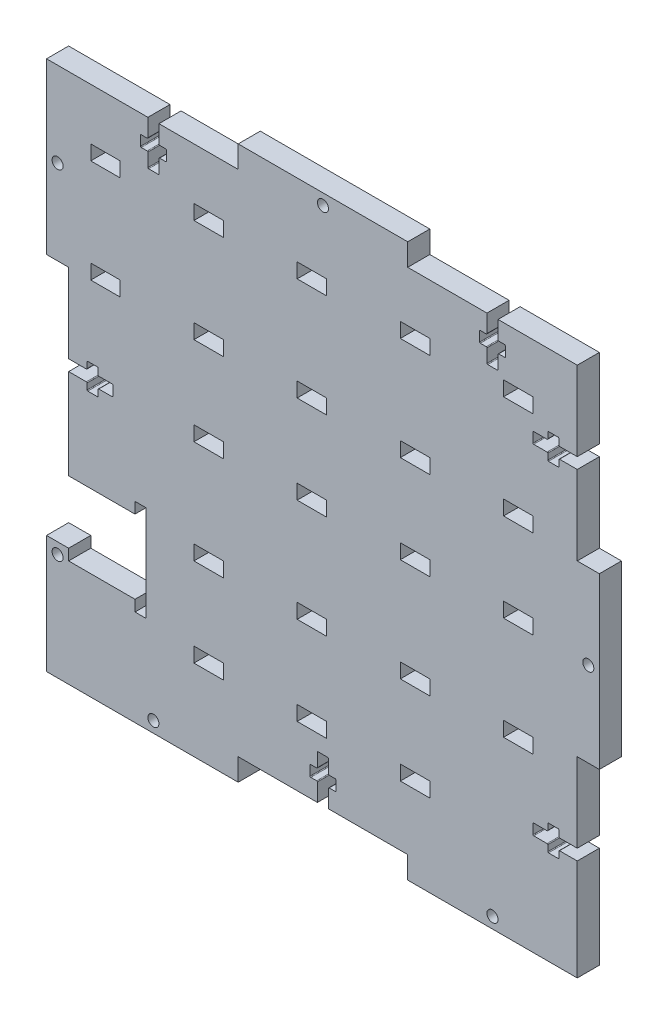
from build123d import *

# Parameters (mm, degrees)
BOX_SIDE_DEPTH       = 6
SKETCH2_R            = 1.5
SCREW_CUT_OUTS_DEPTH = 107.235587258
CUT_EXTRUDE1_DEPTH   = 107.235587258
SKETCH4_W            = 8
SKETCH4_H            = 4
CUT_EXTRUDE2_DEPTH   = 107.235587258


with BuildPart() as part:
    # Sketch1 → Box Side (new body)
    with BuildSketch(Plane.XY):
        Polygon((-69, 69), (-23, 69), (-23, 75), (23, 75), (23, 69), (69, 69), (69, 23), (75, 23), (75, -23), (69, -23), (69, -69), (69, -75), (23, -75), (23, -69), (-23, -69), (-23, -75), (-69, -75), (-75, -75), (-75, -69), (-75, -23), (-69, -23), (-69, 23), (-75, 23), (-75, 69), align=None)
    extrude(amount=BOX_SIDE_DEPTH)

    # Sketch2 → Screw Cut-outs (cut, through all)
    with BuildSketch(Plane.XY.offset(6)):
        with Locations((0, 72)):
            Circle(SKETCH2_R)
        with Locations((72, 0)):
            Circle(SKETCH2_R)
        with Locations((-46, -72)):
            Circle(SKETCH2_R)
        with Locations((46, -72)):
            Circle(SKETCH2_R)
        with Locations((-72, 46)):
            Circle(SKETCH2_R)
        with Locations((-72, -46)):
            Circle(SKETCH2_R)
        with BuildLine():
            Line((-44.5, 69), (-44.5, 64.2))
            ThreePointArc((-44.5, 64.2), (-44.441421356, 64.058578644), (-44.3, 64))
            Line((-44.3, 64), (-42.7, 64))
            ThreePointArc((-42.7, 64), (-42.558578644, 63.941421356), (-42.5, 63.8))
            Line((-42.5, 63.8), (-42.5, 61.2))
            ThreePointArc((-42.5, 61.2), (-42.558578644, 61.058578644), (-42.7, 61))
            Line((-42.7, 61), (-44.3, 61))
            ThreePointArc((-44.3, 61), (-44.441421356, 60.941421356), (-44.5, 60.8))
            Line((-44.5, 60.8), (-44.5, 57.2))
            ThreePointArc((-44.5, 57.2), (-44.558578644, 57.058578644), (-44.7, 57))
            Line((-44.7, 57), (-47.3, 57))
            ThreePointArc((-47.3, 57), (-47.441421356, 57.058578644), (-47.5, 57.2))
            Line((-47.5, 57.2), (-47.5, 60.8))
            ThreePointArc((-47.5, 60.8), (-47.558578644, 60.941421356), (-47.7, 61))
            Line((-47.7, 61), (-49.3, 61))
            ThreePointArc((-49.3, 61), (-49.441421356, 61.058578644), (-49.5, 61.2))
            Line((-49.5, 61.2), (-49.5, 63.8))
            ThreePointArc((-49.5, 63.8), (-49.441421356, 63.941421356), (-49.3, 64))
            Line((-49.3, 64), (-47.7, 64))
            ThreePointArc((-47.7, 64), (-47.558578644, 64.058578644), (-47.5, 64.2))
            Line((-47.5, 64.2), (-47.5, 69))
            Line((-47.5, 69), (-44.5, 69))
        make_face()
        with BuildLine():
            Line((47.5, 69), (47.5, 64.2))
            ThreePointArc((47.5, 64.2), (47.558578644, 64.058578644), (47.7, 64))
            Line((47.7, 64), (49.3, 64))
            ThreePointArc((49.3, 64), (49.441421356, 63.941421356), (49.5, 63.8))
            Line((49.5, 63.8), (49.5, 61.2))
            ThreePointArc((49.5, 61.2), (49.441421356, 61.058578644), (49.3, 61))
            Line((49.3, 61), (47.7, 61))
            ThreePointArc((47.7, 61), (47.558578644, 60.941421356), (47.5, 60.8))
            Line((47.5, 60.8), (47.5, 57.2))
            ThreePointArc((47.5, 57.2), (47.441421356, 57.058578644), (47.3, 57))
            Line((47.3, 57), (44.7, 57))
            ThreePointArc((44.7, 57), (44.558578644, 57.058578644), (44.5, 57.2))
            Line((44.5, 57.2), (44.5, 60.8))
            ThreePointArc((44.5, 60.8), (44.441421356, 60.941421356), (44.3, 61))
            Line((44.3, 61), (42.7, 61))
            ThreePointArc((42.7, 61), (42.558578644, 61.058578644), (42.5, 61.2))
            Line((42.5, 61.2), (42.5, 63.8))
            ThreePointArc((42.5, 63.8), (42.558578644, 63.941421356), (42.7, 64))
            Line((42.7, 64), (44.3, 64))
            ThreePointArc((44.3, 64), (44.441421356, 64.058578644), (44.5, 64.2))
            Line((44.5, 64.2), (44.5, 69))
            Line((44.5, 69), (47.5, 69))
        make_face()
        with BuildLine():
            Line((69, 44.5), (64.2, 44.5))
            ThreePointArc((64.2, 44.5), (64.058578644, 44.441421356), (64, 44.3))
            Line((64, 44.3), (64, 42.7))
            ThreePointArc((64, 42.7), (63.941421356, 42.558578644), (63.8, 42.5))
            Line((63.8, 42.5), (61.2, 42.5))
            ThreePointArc((61.2, 42.5), (61.058578644, 42.558578644), (61, 42.7))
            Line((61, 42.7), (61, 44.3))
            ThreePointArc((61, 44.3), (60.941421356, 44.441421356), (60.8, 44.5))
            Line((60.8, 44.5), (57.2, 44.5))
            ThreePointArc((57.2, 44.5), (57.058578644, 44.558578644), (57, 44.7))
            Line((57, 44.7), (57, 47.3))
            ThreePointArc((57, 47.3), (57.058578644, 47.441421356), (57.2, 47.5))
            Line((57.2, 47.5), (60.8, 47.5))
            ThreePointArc((60.8, 47.5), (60.941421356, 47.558578644), (61, 47.7))
            Line((61, 47.7), (61, 49.3))
            ThreePointArc((61, 49.3), (61.058578644, 49.441421356), (61.2, 49.5))
            Line((61.2, 49.5), (63.8, 49.5))
            ThreePointArc((63.8, 49.5), (63.941421356, 49.441421356), (64, 49.3))
            Line((64, 49.3), (64, 47.7))
            ThreePointArc((64, 47.7), (64.058578644, 47.558578644), (64.2, 47.5))
            Line((64.2, 47.5), (69, 47.5))
            Line((69, 47.5), (69, 44.5))
        make_face()
        with BuildLine():
            Line((69, -47.5), (64.2, -47.5))
            ThreePointArc((64.2, -47.5), (64.058578644, -47.558578644), (64, -47.7))
            Line((64, -47.7), (64, -49.3))
            ThreePointArc((64, -49.3), (63.941421356, -49.441421356), (63.8, -49.5))
            Line((63.8, -49.5), (61.2, -49.5))
            ThreePointArc((61.2, -49.5), (61.058578644, -49.441421356), (61, -49.3))
            Line((61, -49.3), (61, -47.7))
            ThreePointArc((61, -47.7), (60.941421356, -47.558578644), (60.8, -47.5))
            Line((60.8, -47.5), (57.2, -47.5))
            ThreePointArc((57.2, -47.5), (57.058578644, -47.441421356), (57, -47.3))
            Line((57, -47.3), (57, -44.7))
            ThreePointArc((57, -44.7), (57.058578644, -44.558578644), (57.2, -44.5))
            Line((57.2, -44.5), (60.8, -44.5))
            ThreePointArc((60.8, -44.5), (60.941421356, -44.441421356), (61, -44.3))
            Line((61, -44.3), (61, -42.7))
            ThreePointArc((61, -42.7), (61.058578644, -42.558578644), (61.2, -42.5))
            Line((61.2, -42.5), (63.8, -42.5))
            ThreePointArc((63.8, -42.5), (63.941421356, -42.558578644), (64, -42.7))
            Line((64, -42.7), (64, -44.3))
            ThreePointArc((64, -44.3), (64.058578644, -44.441421356), (64.2, -44.5))
            Line((64.2, -44.5), (69, -44.5))
            Line((69, -44.5), (69, -47.5))
        make_face()
        with BuildLine():
            Line((-1.5, -69), (1.5, -69))
            Line((1.5, -69), (1.5, -64.2))
            ThreePointArc((1.5, -64.2), (1.558578644, -64.058578644), (1.7, -64))
            Line((1.7, -64), (3.3, -64))
            ThreePointArc((3.3, -64), (3.441421356, -63.941421356), (3.5, -63.8))
            Line((3.5, -63.8), (3.5, -61.2))
            ThreePointArc((3.5, -61.2), (3.441421356, -61.058578644), (3.3, -61))
            Line((3.3, -61), (1.7, -61))
            ThreePointArc((1.7, -61), (1.558578644, -60.941421356), (1.5, -60.8))
            Line((1.5, -60.8), (1.5, -57.2))
            ThreePointArc((1.5, -57.2), (1.441421356, -57.058578644), (1.3, -57))
            Line((1.3, -57), (-1.3, -57))
            ThreePointArc((-1.3, -57), (-1.441421356, -57.058578644), (-1.5, -57.2))
            Line((-1.5, -57.2), (-1.5, -60.8))
            ThreePointArc((-1.5, -60.8), (-1.558578644, -60.941421356), (-1.7, -61))
            Line((-1.7, -61), (-3.3, -61))
            ThreePointArc((-3.3, -61), (-3.441421356, -61.058578644), (-3.5, -61.2))
            Line((-3.5, -61.2), (-3.5, -63.8))
            ThreePointArc((-3.5, -63.8), (-3.441421356, -63.941421356), (-3.3, -64))
            Line((-3.3, -64), (-1.7, -64))
            ThreePointArc((-1.7, -64), (-1.558578644, -64.058578644), (-1.5, -64.2))
            Line((-1.5, -64.2), (-1.5, -69))
        make_face()
        with BuildLine():
            Line((-69, -1.5), (-64.2, -1.5))
            ThreePointArc((-64.2, -1.5), (-64.058578644, -1.558578644), (-64, -1.7))
            Line((-64, -1.7), (-64, -3.3))
            ThreePointArc((-64, -3.3), (-63.941421356, -3.441421356), (-63.8, -3.5))
            Line((-63.8, -3.5), (-61.2, -3.5))
            ThreePointArc((-61.2, -3.5), (-61.058578644, -3.441421356), (-61, -3.3))
            Line((-61, -3.3), (-61, -1.7))
            ThreePointArc((-61, -1.7), (-60.941421356, -1.558578644), (-60.8, -1.5))
            Line((-60.8, -1.5), (-57.2, -1.5))
            ThreePointArc((-57.2, -1.5), (-57.058578644, -1.441421356), (-57, -1.3))
            Line((-57, -1.3), (-57, 1.3))
            ThreePointArc((-57, 1.3), (-57.058578644, 1.441421356), (-57.2, 1.5))
            Line((-57.2, 1.5), (-60.8, 1.5))
            ThreePointArc((-60.8, 1.5), (-60.941421356, 1.558578644), (-61, 1.7))
            Line((-61, 1.7), (-61, 3.3))
            ThreePointArc((-61, 3.3), (-61.058578644, 3.441421356), (-61.2, 3.5))
            Line((-61.2, 3.5), (-63.8, 3.5))
            ThreePointArc((-63.8, 3.5), (-63.941421356, 3.441421356), (-64, 3.3))
            Line((-64, 3.3), (-64, 1.7))
            ThreePointArc((-64, 1.7), (-64.058578644, 1.558578644), (-64.2, 1.5))
            Line((-64.2, 1.5), (-69, 1.5))
            Line((-69, 1.5), (-69, -1.5))
        make_face()
    extrude(amount=-SCREW_CUT_OUTS_DEPTH, mode=Mode.SUBTRACT)

    # Sketch3 → Cut-Extrude1 (cut, through all)
    with BuildSketch(Plane.XY.offset(6)):
        Polygon((-51, -46), (-51, -49), (-48, -49), (-48, -23), (-51, -23), (-51, -26), (-69, -26), (-69, -23), (-75, -23), (-75, -43), (-69, -43), (-69, -46), align=None)
    extrude(amount=-CUT_EXTRUDE1_DEPTH, mode=Mode.SUBTRACT)

    # Sketch4 → Cut-Extrude2 (cut, through all)
    with BuildSketch(Plane.XY.offset(6)):
        with Locations((-31, 53)):
            Rectangle(SKETCH4_W, SKETCH4_H)
        with Locations((-59, 53)):
            Rectangle(SKETCH4_W, SKETCH4_H)
        with Locations((-31, 25)):
            Rectangle(SKETCH4_W, SKETCH4_H)
        with Locations((-59, 25)):
            Rectangle(SKETCH4_W, SKETCH4_H)
        with Locations((25, 25.283560436)):
            Rectangle(SKETCH4_W, SKETCH4_H)
        with Locations((-3, 25.283560436)):
            Rectangle(SKETCH4_W, SKETCH4_H)
        with Locations((-3, 53.283560436)):
            Rectangle(SKETCH4_W, SKETCH4_H)
        with Locations((25, 53.283560436)):
            Rectangle(SKETCH4_W, SKETCH4_H)
        with Locations((53, 25.567120872)):
            Rectangle(SKETCH4_W, SKETCH4_H)
        with Locations((53, 53.567120872)):
            Rectangle(SKETCH4_W, SKETCH4_H)
        with Locations((25, -26.716439564)):
            Rectangle(SKETCH4_W, SKETCH4_H)
        with Locations((-3, -26.716439564)):
            Rectangle(SKETCH4_W, SKETCH4_H)
        with Locations((-3, 1.283560436)):
            Rectangle(SKETCH4_W, SKETCH4_H)
        with Locations((25, 1.283560436)):
            Rectangle(SKETCH4_W, SKETCH4_H)
        with Locations((53, -26.432879128)):
            Rectangle(SKETCH4_W, SKETCH4_H)
        with Locations((53, 1.567120872)):
            Rectangle(SKETCH4_W, SKETCH4_H)
        with Locations((-3, -50.716439564)):
            Rectangle(SKETCH4_W, SKETCH4_H)
        with Locations((25, -50.716439564)):
            Rectangle(SKETCH4_W, SKETCH4_H)
        with Locations((-31, -27)):
            Rectangle(SKETCH4_W, SKETCH4_H)
        with Locations((-31, 1)):
            Rectangle(SKETCH4_W, SKETCH4_H)
        with Locations((-31, -51)):
            Rectangle(SKETCH4_W, SKETCH4_H)
    extrude(amount=-CUT_EXTRUDE2_DEPTH, mode=Mode.SUBTRACT)


solid = part.part
